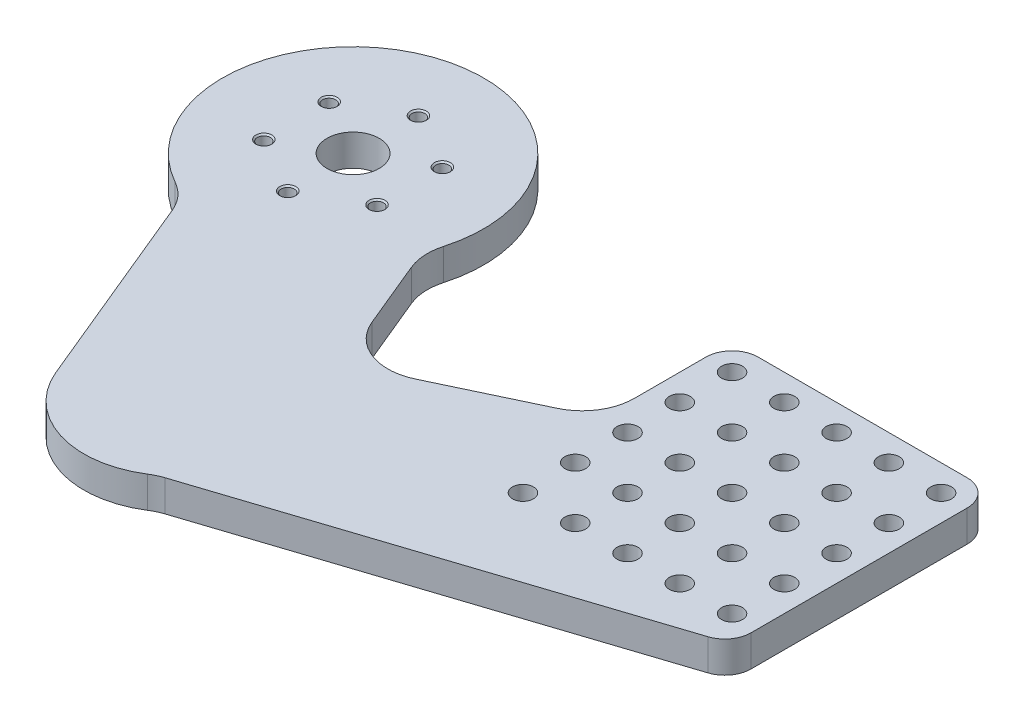
from build123d import *

# Parameters (mm, degrees)
BOSS_EXTRUDE1_DEPTH         = 6
SKETCH2_R                   = 2
CUT_EXTRUDE1_DEPTH          = 10
FILLET5_R                   = 5
FILLET6_R                   = 10
M3_TAPPED_HOLE1_D           = 2.5
M3_TAPPED_HOLE1_CSINK_D     = 3.05
M3_TAPPED_HOLE1_CSINK_ANGLE = 90
SKETCH7_R                   = 5
CUT_EXTRUDE2_DEPTH          = 20.7


with BuildPart() as part:
    # Sketch1 → Boss-Extrude1 (new body)
    with BuildSketch(Plane(origin=(0, 0, 0), x_dir=(1, 0, 0), z_dir=(0, 1, 0))):
        with BuildLine():
            Line((25, -25), (25, 25))
            Line((25, 25), (-25, 25))
            Line((-25, 25), (-25, 0))
            Line((-25, 0), (-58.67491577, -15.931273325))
            Line((-58.67491577, -15.931273325), (-69.499842323, 10.202411171))
            ThreePointArc((-69.499842323, 10.202411171), (-102.067085809, 43.096988313), (-101.835625961, -3.191508961))
            Line((-101.835625961, -3.191508961), (-84.619992775, -44.753724086))
            ThreePointArc((-84.619992775, -44.753724086), (-73.170964947, -54.908539078), (-58.113250316, -52.176189201))
            Line((-58.113250316, -52.176189201), (25, -25))
        make_face()
    extrude(amount=BOSS_EXTRUDE1_DEPTH)

    # Sketch2 → Cut-Extrude1 (cut)
    with BuildSketch(Plane(origin=(0, 6, 0), x_dir=(1, 0, 0), z_dir=(0, 1, 0))):
        with Locations((-20, -20)):
            Circle(SKETCH2_R)
        with Locations((-10, -20)):
            Circle(SKETCH2_R)
        with Locations((0, -20)):
            Circle(SKETCH2_R)
        with Locations((10, -20)):
            Circle(SKETCH2_R)
        with Locations((20, -20)):
            Circle(SKETCH2_R)
        with Locations((-10, -10)):
            Circle(SKETCH2_R)
        with Locations((0, -10)):
            Circle(SKETCH2_R)
        with Locations((10, -10)):
            Circle(SKETCH2_R)
        with Locations((20, -10)):
            Circle(SKETCH2_R)
        with Locations((-10, 0)):
            Circle(SKETCH2_R)
        Circle(SKETCH2_R)
        with Locations((10, 0)):
            Circle(SKETCH2_R)
        with Locations((20, 0)):
            Circle(SKETCH2_R)
        with Locations((-10, 10)):
            Circle(SKETCH2_R)
        with Locations((0, 10)):
            Circle(SKETCH2_R)
        with Locations((10, 10)):
            Circle(SKETCH2_R)
        with Locations((20, 10)):
            Circle(SKETCH2_R)
        with Locations((-10, 20)):
            Circle(SKETCH2_R)
        with Locations((0, 20)):
            Circle(SKETCH2_R)
        with Locations((10, 20)):
            Circle(SKETCH2_R)
        with Locations((20, 20)):
            Circle(SKETCH2_R)
        with Locations((-20, -10)):
            Circle(SKETCH2_R)
        with Locations((-20, 0)):
            Circle(SKETCH2_R)
        with Locations((-20, 10)):
            Circle(SKETCH2_R)
        with Locations((-20, 20)):
            Circle(SKETCH2_R)
    extrude(amount=-CUT_EXTRUDE1_DEPTH, mode=Mode.SUBTRACT)

    # Fillet5
    fillet5_edges = [part.edges().sort_by_distance(p)[0] for p in [
        (25, 3, 25),
        (25, 3, -25),
        (-25, 3, -25),
    ]]
    fillet(fillet5_edges, radius=FILLET5_R)

    # Fillet6
    fillet6_edges = [part.edges().sort_by_distance(p)[0] for p in [
        (-69.499842323, 3, -10.202411171),
        (-101.835625961, 3, 3.191508961),
        (-25, 3, 0),
        (-58.67491577, 3, 15.931273325),
        (-58.113250316, 3, 52.176189201),
    ]]
    fillet(fillet6_edges, radius=FILLET6_R)

    # M3 Tapped Hole1 (through all)
    with Locations(Plane(origin=(0, 6, 0), x_dir=(1, 0, 0), z_dir=(0, 1, 0))):
        with Locations((-103.325317547, 26.25), (-92.5, 32.5), (-81.674682453, 26.25), (-81.674682453, 13.75), (-92.5, 7.5), (-103.325317547, 13.75)):
            CounterSinkHole(M3_TAPPED_HOLE1_D / 2, M3_TAPPED_HOLE1_CSINK_D / 2, counter_sink_angle=M3_TAPPED_HOLE1_CSINK_ANGLE)

    # Sketch7 → Cut-Extrude2 (cut)
    with BuildSketch(Plane(origin=(0, 6, 0), x_dir=(1, 0, 0), z_dir=(0, 1, 0))):
        with Locations((-92.5, 20)):
            Circle(SKETCH7_R)
    extrude(amount=-CUT_EXTRUDE2_DEPTH, mode=Mode.SUBTRACT)


solid = part.part
